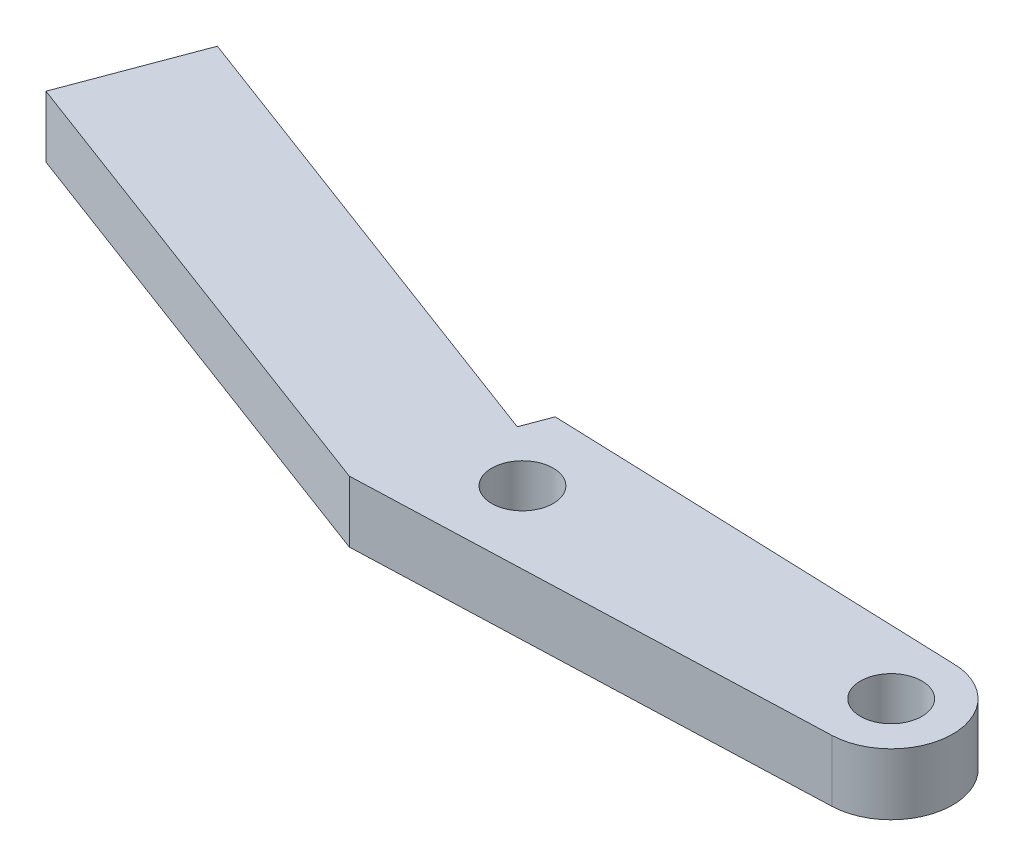
from build123d import *

# Parameters (mm, degrees)
CROQUIS1_R              = 1.5
SALIENTE_EXTRUIR1_DEPTH = 3


with BuildPart() as part:
    # Croquis1 → Saliente-Extruir1 (new body)
    with BuildSketch(Plane(origin=(0, 0, 0), x_dir=(1, 0, 0), z_dir=(0, 1, 0))):
        with BuildLine():
            Line((-5.236894372, 0.753925888), (18.438964967, -8.116090554))
            Line((18.438964967, -8.116090554), (41.184229572, -7.297226676))
            ThreePointArc((41.184229572, -7.297226676), (44.075809358, -4.245192911), (41.076294966, -1.299168951))
            Line((41.076294966, -1.299168951), (20.959029924, -0.583244915))
            Line((20.959029924, -0.583244915), (20.454476686, -1.929999069))
            Line((20.454476686, -1.929999069), (-2.956492375, 6.840777844))
            Line((-2.956492375, 6.840777844), (-5.236894372, 0.753925888))
        make_face()
        with Locations((41.076294966, -4.299168951)):
            Circle(CROQUIS1_R, mode=Mode.SUBTRACT)
        with Locations((23.076294966, -4.299168951)):
            Circle(CROQUIS1_R, mode=Mode.SUBTRACT)
    extrude(amount=SALIENTE_EXTRUIR1_DEPTH)


solid = part.part
